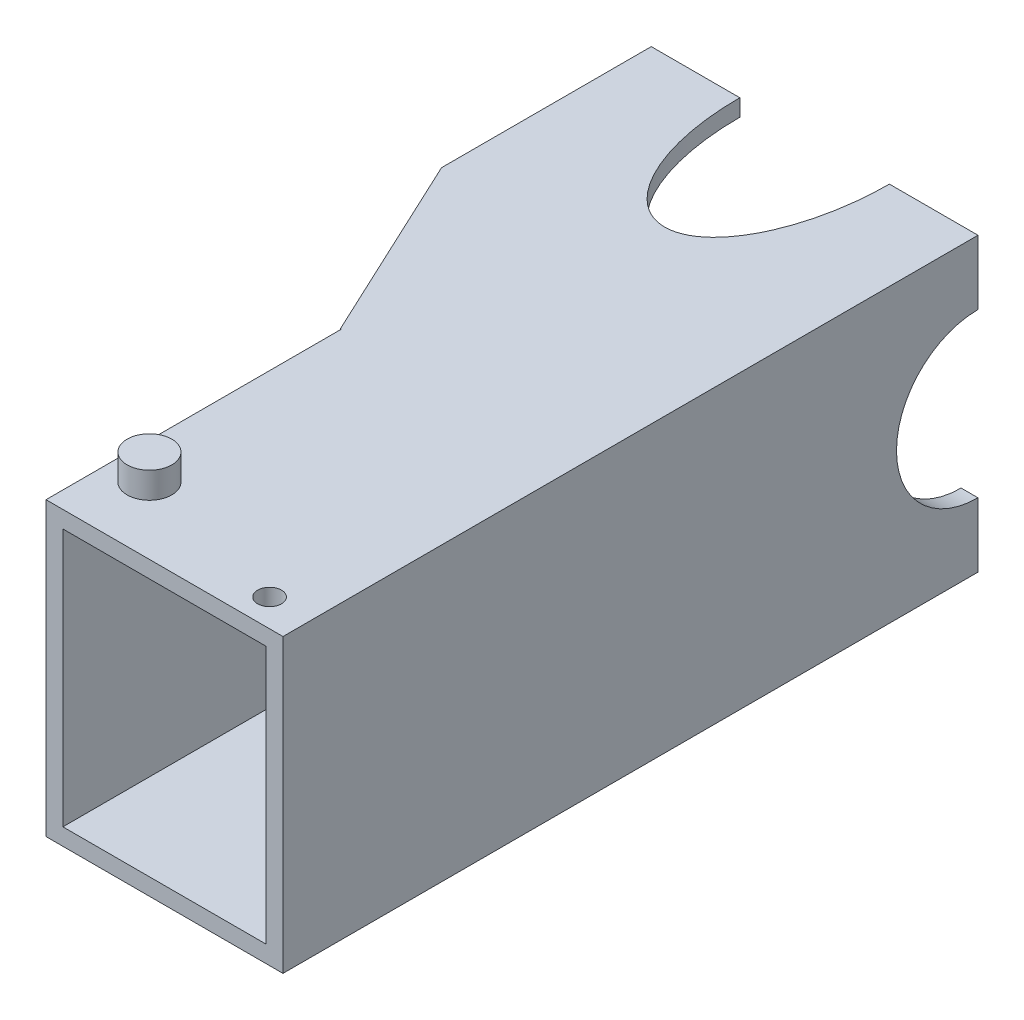
from build123d import *

# Parameters (mm, degrees)
ESQUISSE1_W                 = 43.9
ESQUISSE1_H                 = 39.2
BOSS_EXTRU_1_DEPTH          = 93.38
ESQUISSE2_W                 = 12.06
ESQUISSE2_H                 = 39.7
ENL_V_MAT_EXTRU_1_DEPTH     = 93.38
ENL_V_START                 = -68.408340654
ENL_V_MAT_EXTRU_2_OUTLINE_W = 39.2
ENL_V_MAT_EXTRU_2_OUTLINE_H = 28.154614495
ENL_V_MAT_EXTRU_2_DEPTH     = 16.704392322
ESQUISSE4_W                 = 39.36
ESQUISSE4_H                 = 34.66
ENL_V_MAT_EXTRU_3_DEPTH     = 27.4
ESQUISSE5_W                 = 27.3
ESQUISSE5_H                 = 34.66
ENL_V_MAT_EXTRU_4_DEPTH     = 100
ENL_V_START_2               = -2.27
ESQUISSE6_W                 = 28.461412474
ESQUISSE6_H                 = 34.66
ENL_V_MAT_EXTRU_7_DEPTH     = 20
CONG_2_R                    = 10
ESQUISSE7_R                 = 3
BOSS_EXTRU_2_DEPTH          = 3.5
BOSS_EXTRU_3_START          = 3.5
ESQUISSE8_R                 = 3
BOSS_EXTRU_3_DEPTH          = 3.5
ESQUISSE9_R                 = 1.6
ENL_V_MAT_EXTRU_8_DEPTH     = 3.5
ESQUISSE10_RX               = 20.100105099
ESQUISSE10_RY               = 10.05
ENL_V_MAT_EXTRU_9_DEPTH     = 100
ESQUISSE12_R                = 10.95
ENL_V_MAT_EXTRU_10_DEPTH    = 100


with BuildPart() as part:
    # Esquisse1 → Boss.-Extru.1 (new body)
    with BuildSketch(Plane.XY):
        with Locations((-21.95, -19.6)):
            Rectangle(ESQUISSE1_W, ESQUISSE1_H)
    extrude(amount=BOSS_EXTRU_1_DEPTH)

    # Esquisse2 → Enlèv. mat.-Extru.1 (cut)
    with BuildSketch(Plane(origin=(0, 0, 0), x_dir=(1, 0, 0), z_dir=(0, 1, 0))):
        with Locations((-37.87, -73.53)):
            Rectangle(ESQUISSE2_W, ESQUISSE2_H)
    extrude(amount=-ENL_V_MAT_EXTRU_1_DEPTH, mode=Mode.SUBTRACT)

    # Enlèv. mat.-Extru.2: read off the stored shape, not the designer's step
    # Enlèv. mat.-Extru.2 outline → Enlèv. mat.-Extru.2 (cut)
    with BuildSketch(Plane(origin=(0, 0, 0), x_dir=(0, 1, 0), z_dir=(0.905787793342715, 0, -0.423731605419439)).offset(ENL_V_START)):
        with Locations((-19.6, 20.998682073)):
            Rectangle(ENL_V_MAT_EXTRU_2_OUTLINE_W, ENL_V_MAT_EXTRU_2_OUTLINE_H)
    extrude(amount=ENL_V_MAT_EXTRU_2_DEPTH, mode=Mode.SUBTRACT)

    # Esquisse4 → Enlèv. mat.-Extru.3 (cut)
    with BuildSketch(Plane(origin=(0, 0, 0), x_dir=(-1, 0, 0), z_dir=(0, 0, -1))):
        with Locations((21.95, -19.6)):
            Rectangle(ESQUISSE4_W, ESQUISSE4_H)
    extrude(amount=-ENL_V_MAT_EXTRU_3_DEPTH, mode=Mode.SUBTRACT)

    # Esquisse5 → Enlèv. mat.-Extru.4 (cut)
    with BuildSketch(Plane.XY.offset(93.38)):
        with Locations((-15.92, -19.6)):
            Rectangle(ESQUISSE5_W, ESQUISSE5_H)
    extrude(amount=-ENL_V_MAT_EXTRU_4_DEPTH, mode=Mode.SUBTRACT)

    # Esquisse6 → Enlèv. mat.-Extru.7 (cut)
    with BuildSketch(Plane(origin=(-46.832805267, 0, 21.908597033), x_dir=(0.42373160541943916, 0, 0.9057877933427149), z_dir=(-0.9057877933427149, 0, 0.42373160541943916)).offset(ENL_V_START_2)):
        with Locations((21.152081063, -19.6)):
            Rectangle(ESQUISSE6_W, ESQUISSE6_H)
    extrude(amount=-ENL_V_MAT_EXTRU_7_DEPTH, mode=Mode.SUBTRACT)

    # Congé2
    # the kernel refuses this fillet: 10 mm, written as the material it takes off along each edge
    with BuildSketch(Plane(origin=(-29.57, -36.93, 52.89597765), x_dir=(0, 0, 1), z_dir=(0, 1, 0))) as cong_2_piece_1:
        with BuildLine():
            CenterArc((2.157105836, -10), CONG_2_R, 90, 11.870832878)
            Line((0.10004547, -0.213861709), (0, 0))
            Line((0, 0), (2.157105836, 0))
        make_face()
    extrude(amount=34.66, mode=Mode.SUBTRACT)

    # Esquisse7 → Boss.-Extru.2 (add)
    with BuildSketch(Plane(origin=(0, -39.2, 0), x_dir=(-1, 0, 0), z_dir=(0, -1, 0))):
        with Locations((26.94, -84.38)):
            Circle(ESQUISSE7_R)
    extrude(amount=BOSS_EXTRU_2_DEPTH)

    # Esquisse8 → Boss.-Extru.3 (add)
    with BuildSketch(Plane(origin=(0, 0, 0), x_dir=(1, 0, 0), z_dir=(0, 1, 0)).offset(BOSS_EXTRU_3_START)):
        with Locations(Location((-26.94, -84.38, 0), (0, 0, 180))):
            Circle(ESQUISSE8_R)
    extrude(amount=-BOSS_EXTRU_3_DEPTH)

    # Esquisse9 → Enlèv. mat.-Extru.8 (cut)
    with BuildSketch(Plane(origin=(0, 0, 0), x_dir=(1, 0, 0), z_dir=(0, 1, 0))):
        with Locations(Location((-5.5, -89.68, 0), (0, 0, 180))):
            Circle(ESQUISSE9_R)
    extrude(amount=-ENL_V_MAT_EXTRU_8_DEPTH, mode=Mode.SUBTRACT)

    # Esquisse10 → Enlèv. mat.-Extru.9 (cut)
    with BuildSketch(Plane(origin=(0, 0, 0), x_dir=(1, 0, 0), z_dir=(0, 1, 0))):
        with Locations(Location((-21.95, 0), (0, 0, 89.814715787))):
            Ellipse(ESQUISSE10_RX, ESQUISSE10_RY)
    extrude(amount=-ENL_V_MAT_EXTRU_9_DEPTH, mode=Mode.SUBTRACT)

    # Esquisse12 → Enlèv. mat.-Extru.10 (cut)
    with BuildSketch(Plane(origin=(0, 0, 0), x_dir=(0, 0, -1), z_dir=(1, 0, 0))):
        with Locations((0, -19.6)):
            Circle(ESQUISSE12_R)
    extrude(amount=-ENL_V_MAT_EXTRU_10_DEPTH, mode=Mode.SUBTRACT)


solid = part.part
